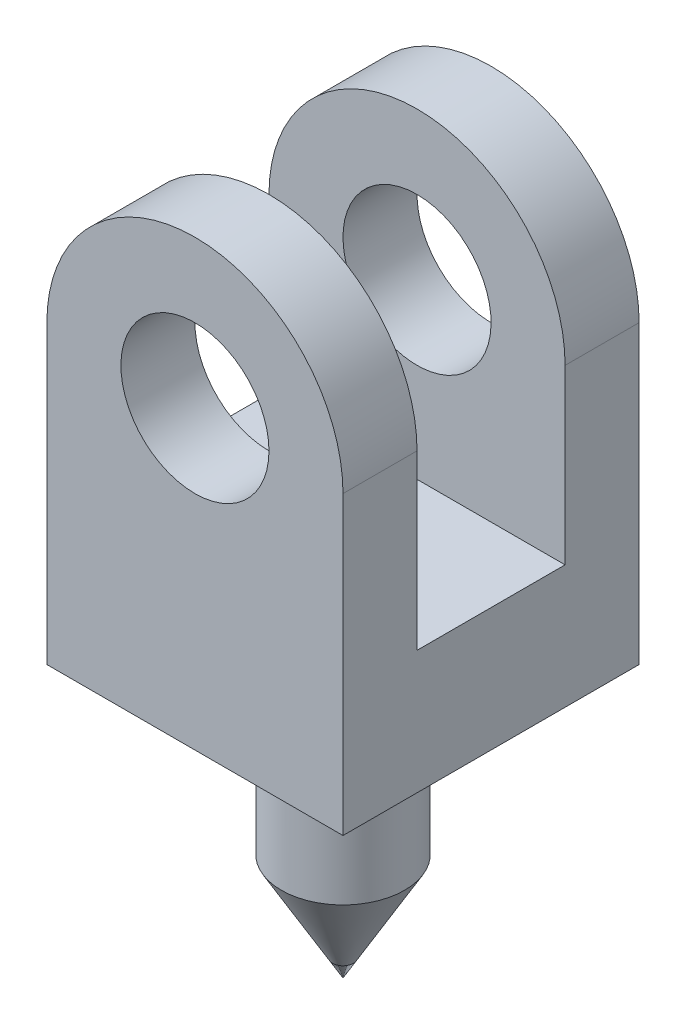
from build123d import *

# Parameters (mm, degrees)
SKETCH1_R           = 6
BOSS_EXTRUDE1_DEPTH = 12
SKETCH4_W           = 12
SKETCH4_H           = 26
CUT_EXTRUDE1_DEPTH  = 54.25410789


with BuildPart() as part:
    # Sketch1 → Boss-Extrude1 (new, symmetric)
    with BuildSketch(Plane.XY):
        with BuildLine():
            Line((-12, 0), (-12, -24))
            Line((-12, -24), (12, -24))
            Line((12, -24), (12, 0))
            ThreePointArc((12, 0), (0, 12), (-12, 0))
        make_face()
        Circle(SKETCH1_R, mode=Mode.SUBTRACT)
    extrude(amount=BOSS_EXTRUDE1_DEPTH, both=True)

    # Loft1: read off the stored shape, not the designer's step
    # Loft1: loft between two sections, ruled curve by curve
    loft1_from = [
        Edge.make_bspline([(3.535533906, -31, 3.535533906), (3.952200573, -31, 3.118867239), (4.325792981, -31, 2.593397212), (4.720167594, -31, 1.6821315), (4.823924825, -31, 1.358816515), (4.963884467, -31, 0.690278229), (5, -31, 0.345177969), (5, -31, -0.345177969), (4.963884467, -31, -0.690278229), (4.823924825, -31, -1.358816515), (4.720167594, -31, -1.6821315), (4.325792981, -31, -2.593397212), (3.952200573, -31, -3.118867239), (3.535533906, -31, -3.535533906)], [0, 0, 0, 0, 0.25, 0.25, 0.375, 0.375, 0.5, 0.5, 0.625, 0.625, 0.75, 0.75, 1, 1, 1, 1], 3),
        Edge.make_bspline([(3.535533906, -31, -3.535533906), (3.118867239, -31, -3.952200573), (2.593397212, -31, -4.325792981), (1.6821315, -31, -4.720167594), (1.358816515, -31, -4.823924825), (0.690278229, -31, -4.963884467), (0.345177969, -31, -5), (-0.345177969, -31, -5), (-0.690278229, -31, -4.963884467), (-1.358816515, -31, -4.823924825), (-1.6821315, -31, -4.720167594), (-2.593397212, -31, -4.325792981), (-3.118867239, -31, -3.952200573), (-3.535533906, -31, -3.535533906)], [0, 0, 0, 0, 0.25, 0.25, 0.375, 0.375, 0.5, 0.5, 0.625, 0.625, 0.75, 0.75, 1, 1, 1, 1], 3),
        Edge.make_bspline([(-3.535533906, -31, 3.535533906), (-3.118867239, -31, 3.952200573), (-2.593397212, -31, 4.325792981), (-1.6821315, -31, 4.720167594), (-1.358816515, -31, 4.823924825), (-0.690278229, -31, 4.963884467), (-0.345177969, -31, 5), (0.345177969, -31, 5), (0.690278229, -31, 4.963884467), (1.358816515, -31, 4.823924825), (1.6821315, -31, 4.720167594), (2.593397212, -31, 4.325792981), (3.118867239, -31, 3.952200573), (3.535533906, -31, 3.535533906)], [0, 0, 0, 0, 0.25, 0.25, 0.375, 0.375, 0.5, 0.5, 0.625, 0.625, 0.75, 0.75, 1, 1, 1, 1], 3),
        Edge.make_bspline([(-3.535533906, -31, -3.535533906), (-3.952200573, -31, -3.118867239), (-4.325792981, -31, -2.593397212), (-4.720167594, -31, -1.6821315), (-4.823924825, -31, -1.358816515), (-4.963884467, -31, -0.690278229), (-5, -31, -0.345177969), (-5, -31, 0.345177969), (-4.963884467, -31, 0.690278229), (-4.823924825, -31, 1.358816515), (-4.720167594, -31, 1.6821315), (-4.325792981, -31, 2.593397212), (-3.952200573, -31, 3.118867239), (-3.535533906, -31, 3.535533906)], [0, 0, 0, 0, 0.25, 0.25, 0.375, 0.375, 0.5, 0.5, 0.625, 0.625, 0.75, 0.75, 1, 1, 1, 1], 3),
    ]
    loft1_to = [
        Edge.make_bspline([(12, -24, 12), (12, -24, 10), (12, -24, 8), (12, -24, 5), (12, -24, 4), (12, -24, 2), (12, -24, 1), (12, -24, -1), (12, -24, -2), (12, -24, -4), (12, -24, -5), (12, -24, -8), (12, -24, -10), (12, -24, -12)], [0, 0, 0, 0, 0.25, 0.25, 0.375, 0.375, 0.5, 0.5, 0.625, 0.625, 0.75, 0.75, 1, 1, 1, 1], 3),
        Edge.make_bspline([(12, -24, -12), (10, -24, -12), (8, -24, -12), (5, -24, -12), (4, -24, -12), (2, -24, -12), (1, -24, -12), (-1, -24, -12), (-2, -24, -12), (-4, -24, -12), (-5, -24, -12), (-8, -24, -12), (-10, -24, -12), (-12, -24, -12)], [0, 0, 0, 0, 0.25, 0.25, 0.375, 0.375, 0.5, 0.5, 0.625, 0.625, 0.75, 0.75, 1, 1, 1, 1], 3),
        Edge.make_bspline([(-12, -24, 12), (-10, -24, 12), (-8, -24, 12), (-5, -24, 12), (-4, -24, 12), (-2, -24, 12), (-1, -24, 12), (1, -24, 12), (2, -24, 12), (4, -24, 12), (5, -24, 12), (8, -24, 12), (10, -24, 12), (12, -24, 12)], [0, 0, 0, 0, 0.25, 0.25, 0.375, 0.375, 0.5, 0.5, 0.625, 0.625, 0.75, 0.75, 1, 1, 1, 1], 3),
        Edge.make_bspline([(-12, -24, -12), (-12, -24, -10), (-12, -24, -8), (-12, -24, -5), (-12, -24, -4), (-12, -24, -2), (-12, -24, -1), (-12, -24, 1), (-12, -24, 2), (-12, -24, 4), (-12, -24, 5), (-12, -24, 8), (-12, -24, 10), (-12, -24, 12)], [0, 0, 0, 0, 0.25, 0.25, 0.375, 0.375, 0.5, 0.5, 0.625, 0.625, 0.75, 0.75, 1, 1, 1, 1], 3),
    ]
    loft1 = Solid(Shell([*[Face.make_surface_from_curves(loft1_from[k], loft1_to[k]) for k in range(4)], Face(Wire(loft1_from)), Face(Wire(loft1_to))]))
    add(loft1)

    # Sketch3 → Revolve1 (revolve)
    with BuildSketch(Plane.XY, mode=Mode.PRIVATE) as revolve1_sk:
        Polygon((-5, -31), (-5, -37.339745962), (0, -46), (0, -31), align=None)
    revolve(revolve1_sk.sketch.rotate(Axis((0, -46, 0), (0, 1, 0)), 180), axis=Axis((0, -46, 0), (0, 1, 0)))

    # Sketch4 → Cut-Extrude1 (cut, through all)
    with BuildSketch(Plane(origin=(12, 0, 0), x_dir=(0, 0, -1), z_dir=(1, 0, 0))):
        with Locations((0, -1)):
            Rectangle(SKETCH4_W, SKETCH4_H)
    extrude(amount=-CUT_EXTRUDE1_DEPTH, mode=Mode.SUBTRACT)


solid = part.part
